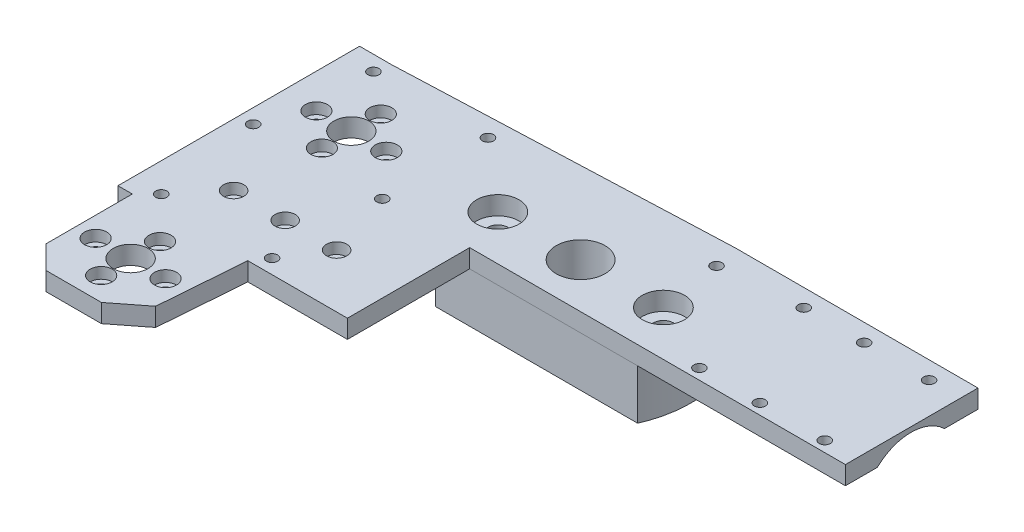
from build123d import *
from build123d.topology import SkipClean

# Parameters (mm, degrees)
BOSS_EXTRUDE2_DEPTH      = 5
BOSS_EXTRUDE3_DEPTH      = 7.754729404
CHAMFER1_SIZE            = 5
CUT_EXTRUDE1_REACH       = 141.557
SKETCH3_R                = 1.25
SKETCH3_R_2              = 4.75
SKETCH3_R_3              = 1.5
CUT_EXTRUDE2_REACH       = 141.924
SKETCH4_R                = 6.631653289
SKETCH5_R                = 1.5
SKETCH5_R_2              = 1.25
CUT_EXTRUDE3_DEPTH       = 5
SKETCH6_R                = 3.491700942
CUT_EXTRUDE4_DEPTH       = 16
SKETCH7_R                = 3
SKETCH7_R_2              = 2.75
SKETCH7_R_3              = 5.75
CUT_EXTRUDE5_DEPTH       = 3
SKETCH8_R                = 5.75
SKETCH8_R_2              = 2.75
CUT_EXTRUDE6_DEPTH       = 2
SKETCH9_R                = 2.75
SKETCH9_R_2              = 6.631653289
BOSS_EXTRUDE4_DEPTH      = 6
SKETCH_2_W               = 117.397038357
SKETCH_2_H               = 38.743798428
CUT_EXTRUDE_1_DEPTH      = 10
CUT_EXTRUDE_2_DEPTH      = 4
CUT_EXTRUDE_2_DEPTH_BACK = 67
SKETCH_3_R               = 13.2
SKETCH_4_R               = 1.5
CUT_EXTRUDE_3_DEPTH      = 141.019029031


with BuildPart() as part:
    # Sketch1 → Boss-Extrude2 (new body)
    with BuildSketch(Plane(origin=(0, 5, 0), x_dir=(1, 0, 0), z_dir=(0, 1, 0))):
        Polygon((-59.07123662, -89.170861083), (-52.784617119, -95.434905202), (-37.7519372, -95.434905202), (-29.475784547, -88.962915789), (-27.671734368, -65.713921864), (18.946867386, -65.713921864), (44.47116766, -32.695405711), (101.529871362, -32.695405711), (101.529871362, 3.549485717), (35.581177978, 3.549485717), (-54.339944406, -0.035926105), (-62.97271212, -0.035926105), (-62.97271212, -65.713921864), (-59.07123662, -65.713921864), align=None)
    extrude(amount=-BOSS_EXTRUDE2_DEPTH)

    # Sketch2 → Boss-Extrude3 (add)
    with BuildSketch(Plane.XZ):
        with BuildLine():
            Line((-10.176598849, 8.251513657), (44.814309491, 8.251513657))
            ThreePointArc((44.814309491, 8.251513657), (46.686044709, 14.122224346), (47.318855321, 20.251513657))
            ThreePointArc((47.318855321, 20.251513657), (46.686044709, 26.380802967), (44.814309491, 32.251513657))
            Line((44.814309491, 32.251513657), (-10.176598849, 32.251513657))
            ThreePointArc((-10.176598849, 32.251513657), (-12.681144679, 20.251513657), (-10.176598849, 8.251513657))
        make_face()
    extrude(amount=BOSS_EXTRUDE3_DEPTH)

    # Chamfer1
    chamfer1_edges = [part.edges().sort_by_distance(p)[0] for p in [
        (-12.681144679, 0, 20.251513657),
        (17.318855321, 0, 8.251513657),
    ]]
    chamfer(chamfer1_edges, length=CHAMFER1_SIZE)

    # Sketch3 → Cut-Extrude1 (cut, up to next)
    with BuildSketch(Plane.XZ, mode=Mode.PRIVATE) as cut_extrude1_sk1:
        with Locations(Location((-18.116122786, 51.13040511, 0), (0, 0, 270))):
            Circle(SKETCH3_R)
    cut_extrude1_tool1 = extrude(cut_extrude1_sk1.sketch, amount=-CUT_EXTRUDE1_REACH, mode=Mode.PRIVATE) & part.part
    # Sketch3 → Cut-Extrude1 (cut, up to next)
    with BuildSketch(Plane.XZ, mode=Mode.PRIVATE) as cut_extrude1_sk2:
        with Locations(Location((-32.116122786, 51.13040511, 0), (0, 0, 270))):
            Circle(SKETCH3_R)
    cut_extrude1_tool2 = extrude(cut_extrude1_sk2.sketch, amount=-CUT_EXTRUDE1_REACH, mode=Mode.PRIVATE) & part.part
    # Sketch3 → Cut-Extrude1 (cut, up to next)
    with BuildSketch(Plane.XZ, mode=Mode.PRIVATE) as cut_extrude1_sk3:
        with Locations(Location((-46.116122786, 51.13040511, 0), (0, 0, 270))):
            Circle(SKETCH3_R)
    cut_extrude1_tool3 = extrude(cut_extrude1_sk3.sketch, amount=-CUT_EXTRUDE1_REACH, mode=Mode.PRIVATE) & part.part
    # Sketch3 → Cut-Extrude1 (cut, up to next)
    with BuildSketch(Plane.XZ, mode=Mode.PRIVATE) as cut_extrude1_sk4:
        with Locations(Location((-44.116122786, 21.13040511, 0), (0, 0, 270))):
            Circle(SKETCH3_R_2)
    cut_extrude1_tool4 = extrude(cut_extrude1_sk4.sketch, amount=-CUT_EXTRUDE1_REACH, mode=Mode.PRIVATE) & part.part
    # Sketch3 → Cut-Extrude1 (cut, up to next)
    with BuildSketch(Plane.XZ, mode=Mode.PRIVATE) as cut_extrude1_sk5:
        with Locations(Location((-44.116122786, 81.13040511, 0), (0, 0, 270))):
            Circle(SKETCH3_R_2)
    cut_extrude1_tool5 = extrude(cut_extrude1_sk5.sketch, amount=-CUT_EXTRUDE1_REACH, mode=Mode.PRIVATE) & part.part
    # Sketch3 → Cut-Extrude1 (cut, up to next)
    with BuildSketch(Plane.XZ, mode=Mode.PRIVATE) as cut_extrude1_sk6:
        with Locations(Location((-34.616122786, 81.13040511, 0), (0, 0, 270))):
            Circle(SKETCH3_R_3)
    cut_extrude1_tool6 = extrude(cut_extrude1_sk6.sketch, amount=-CUT_EXTRUDE1_REACH, mode=Mode.PRIVATE) & part.part
    # Sketch3 → Cut-Extrude1 (cut, up to next)
    with BuildSketch(Plane.XZ, mode=Mode.PRIVATE) as cut_extrude1_sk7:
        with Locations(Location((-44.116122786, 73.13040511, 0), (0, 0, 270))):
            Circle(SKETCH3_R_3)
    cut_extrude1_tool7 = extrude(cut_extrude1_sk7.sketch, amount=-CUT_EXTRUDE1_REACH, mode=Mode.PRIVATE) & part.part
    # Sketch3 → Cut-Extrude1 (cut, up to next)
    with BuildSketch(Plane.XZ, mode=Mode.PRIVATE) as cut_extrude1_sk8:
        with Locations(Location((-53.616122786, 81.13040511, 0), (0, 0, 270))):
            Circle(SKETCH3_R_3)
    cut_extrude1_tool8 = extrude(cut_extrude1_sk8.sketch, amount=-CUT_EXTRUDE1_REACH, mode=Mode.PRIVATE) & part.part
    # Sketch3 → Cut-Extrude1 (cut, up to next)
    with BuildSketch(Plane.XZ, mode=Mode.PRIVATE) as cut_extrude1_sk9:
        with Locations(Location((-44.116122786, 89.13040511, 0), (0, 0, 270))):
            Circle(SKETCH3_R_3)
    cut_extrude1_tool9 = extrude(cut_extrude1_sk9.sketch, amount=-CUT_EXTRUDE1_REACH, mode=Mode.PRIVATE) & part.part
    # Sketch3 → Cut-Extrude1 (cut, up to next)
    with BuildSketch(Plane.XZ, mode=Mode.PRIVATE) as cut_extrude1_sk10:
        with Locations(Location((-53.616122786, 21.13040511, 0), (0, 0, 270))):
            Circle(SKETCH3_R_3)
    cut_extrude1_tool10 = extrude(cut_extrude1_sk10.sketch, amount=-CUT_EXTRUDE1_REACH, mode=Mode.PRIVATE) & part.part
    # Sketch3 → Cut-Extrude1 (cut, up to next)
    with BuildSketch(Plane.XZ, mode=Mode.PRIVATE) as cut_extrude1_sk11:
        with Locations(Location((-44.116122786, 13.13040511, 0), (0, 0, 270))):
            Circle(SKETCH3_R_3)
    cut_extrude1_tool11 = extrude(cut_extrude1_sk11.sketch, amount=-CUT_EXTRUDE1_REACH, mode=Mode.PRIVATE) & part.part
    # Sketch3 → Cut-Extrude1 (cut, up to next)
    with BuildSketch(Plane.XZ, mode=Mode.PRIVATE) as cut_extrude1_sk12:
        with Locations(Location((-34.616122786, 21.13040511, 0), (0, 0, 270))):
            Circle(SKETCH3_R_3)
    cut_extrude1_tool12 = extrude(cut_extrude1_sk12.sketch, amount=-CUT_EXTRUDE1_REACH, mode=Mode.PRIVATE) & part.part
    # Sketch3 → Cut-Extrude1 (cut, up to next)
    with BuildSketch(Plane.XZ, mode=Mode.PRIVATE) as cut_extrude1_sk13:
        with Locations(Location((-44.116122786, 29.13040511, 0), (0, 0, 270))):
            Circle(SKETCH3_R_3)
    cut_extrude1_tool13 = extrude(cut_extrude1_sk13.sketch, amount=-CUT_EXTRUDE1_REACH, mode=Mode.PRIVATE) & part.part
    add(cut_extrude1_tool1.solids().sort_by_distance((-18.116123, 0, 51.130405))[0], mode=Mode.SUBTRACT)
    add(cut_extrude1_tool2.solids().sort_by_distance((-32.116123, 0, 51.130405))[0], mode=Mode.SUBTRACT)
    add(cut_extrude1_tool3.solids().sort_by_distance((-46.116123, 0, 51.130405))[0], mode=Mode.SUBTRACT)
    add(cut_extrude1_tool4.solids().sort_by_distance((-44.116123, 0, 21.130405))[0], mode=Mode.SUBTRACT)
    add(cut_extrude1_tool5.solids().sort_by_distance((-44.116123, 0, 81.130405))[0], mode=Mode.SUBTRACT)
    add(cut_extrude1_tool6.solids().sort_by_distance((-34.616123, 0, 81.130405))[0], mode=Mode.SUBTRACT)
    add(cut_extrude1_tool7.solids().sort_by_distance((-44.116123, 0, 73.130405))[0], mode=Mode.SUBTRACT)
    add(cut_extrude1_tool8.solids().sort_by_distance((-53.616123, 0, 81.130405))[0], mode=Mode.SUBTRACT)
    add(cut_extrude1_tool9.solids().sort_by_distance((-44.116123, 0, 89.130405))[0], mode=Mode.SUBTRACT)
    add(cut_extrude1_tool10.solids().sort_by_distance((-53.616123, 0, 21.130405))[0], mode=Mode.SUBTRACT)
    add(cut_extrude1_tool11.solids().sort_by_distance((-44.116123, 0, 13.130405))[0], mode=Mode.SUBTRACT)
    add(cut_extrude1_tool12.solids().sort_by_distance((-34.616123, 0, 21.130405))[0], mode=Mode.SUBTRACT)
    add(cut_extrude1_tool13.solids().sort_by_distance((-44.116123, 0, 29.130405))[0], mode=Mode.SUBTRACT)

    # Sketch4 → Cut-Extrude2 (cut, up to next)
    with BuildSketch(Plane.XZ.offset(7.754729404), mode=Mode.PRIVATE) as cut_extrude2_sk1:
        with Locations((17.318855321, 20.251513657)):
            Circle(SKETCH4_R)
    cut_extrude2_tool1 = extrude(cut_extrude2_sk1.sketch, amount=-CUT_EXTRUDE2_REACH, mode=Mode.PRIVATE) & part.part
    # Sketch4 → Cut-Extrude2 (cut, up to next)
    with BuildSketch(Plane.XZ.offset(7.754729404), mode=Mode.PRIVATE) as cut_extrude2_sk2:
        with BuildLine():
            ThreePointArc((-2.431144679, 20.251513657), (-5.181144679, 23.001513657), (-7.931144679, 20.251513657))
            ThreePointArc((-7.931144679, 20.251513657), (-5.181144679, 17.501513657), (-2.431144679, 20.251513657))
        make_face()
    cut_extrude2_tool2 = extrude(cut_extrude2_sk2.sketch, amount=-CUT_EXTRUDE2_REACH, mode=Mode.PRIVATE) & part.part
    # Sketch4 → Cut-Extrude2 (cut, up to next)
    with BuildSketch(Plane.XZ.offset(7.754729404), mode=Mode.PRIVATE) as cut_extrude2_sk3:
        with BuildLine():
            ThreePointArc((37.068855321, 20.251513657), (39.818855321, 17.501513657), (42.568855321, 20.251513657))
            ThreePointArc((42.568855321, 20.251513657), (39.818855321, 23.001513657), (37.068855321, 20.251513657))
        make_face()
    cut_extrude2_tool3 = extrude(cut_extrude2_sk3.sketch, amount=-CUT_EXTRUDE2_REACH, mode=Mode.PRIVATE) & part.part
    add(cut_extrude2_tool1.solids().sort_by_distance((17.318855, -7.754729, 20.251514))[0], mode=Mode.SUBTRACT)
    add(cut_extrude2_tool2.solids().sort_by_distance((-5.181145, -7.754729, 20.251514))[0], mode=Mode.SUBTRACT)
    add(cut_extrude2_tool3.solids().sort_by_distance((39.818855, -7.754729, 20.251514))[0], mode=Mode.SUBTRACT)

    # Sketch5 → Cut-Extrude3 (cut)
    with BuildSketch(Plane(origin=(0, 0, 0), x_dir=(-1, 0, 0), z_dir=(0, -1, 0))):
        with Locations(Location((55.099934193, -4.140497737, 0), (0, 0, 90))):
            Circle(SKETCH5_R)
        with Locations(Location((59.058385613, -32.874923984, 0), (0, 0, 90))):
            Circle(SKETCH5_R)
        with Locations(Location((23.973639777, -4.140497737, 0), (0, 0, 90))):
            Circle(SKETCH5_R)
        with Locations(Location((23.973639777, -32.874923984, 0), (0, 0, 90))):
            Circle(SKETCH5_R)
        with Locations(Location((-37.259026719, -36.796202548, 0), (0, 0, 90))):
            Circle(SKETCH5_R)
        with Locations(Location((-14.468099575, -36.796202548, 0), (0, 0, 90))):
            Circle(SKETCH5_R)
        with Locations(Location((18.116122786, -51.13040511, 0), (0, 0, 90))):
            Circle(SKETCH5_R_2)
        with Locations(Location((32.116122786, -51.13040511, 0), (0, 0, 90))):
            Circle(SKETCH5_R_2)
        with Locations(Location((46.116122786, -51.13040511, 0), (0, 0, 90))):
            Circle(SKETCH5_R_2)
        with Locations(Location((55.099934193, -61.807320837, 0), (0, 0, 90))):
            Circle(SKETCH5_R)
        with Locations(Location((24.982681883, -61.807320837, 0), (0, 0, 90))):
            Circle(SKETCH5_R)
        with Locations(Location((-16.884070867, -61.807320837, 0), (0, 0, 90))):
            Circle(SKETCH5_R)
        with Locations(Location((-37.259026719, -3.251513657, 0), (0, 0, 90))):
            Circle(SKETCH5_R)
    extrude(amount=-CUT_EXTRUDE3_DEPTH, mode=Mode.SUBTRACT)

    # Sketch6 → Cut-Extrude4 (cut)
    with BuildSketch(Plane.XZ):
        with Locations((37.259026719, 3.251513657)):
            Circle(SKETCH6_R)
    extrude(amount=CUT_EXTRUDE4_DEPTH, mode=Mode.SUBTRACT)

    # Sketch7 → Cut-Extrude5 (cut)
    with BuildSketch(Plane(origin=(0, 5, 0), x_dir=(1, 0, 0), z_dir=(0, 1, 0))):
        with Locations(Location((-44.116122786, -89.13040511, 0), (0, 0, 270))):
            Circle(SKETCH7_R)
        with Locations(Location((-34.616122786, -81.13040511, 0), (0, 0, 270))):
            Circle(SKETCH7_R)
        with Locations(Location((-53.616122786, -81.13040511, 0), (0, 0, 270))):
            Circle(SKETCH7_R)
        with Locations(Location((-44.116122786, -73.13040511, 0), (0, 0, 270))):
            Circle(SKETCH7_R)
        with Locations(Location((-44.116122786, -29.13040511, 0), (0, 0, 270))):
            Circle(SKETCH7_R)
        with Locations(Location((-34.616122786, -21.13040511, 0), (0, 0, 270))):
            Circle(SKETCH7_R)
        with Locations(Location((-53.616122786, -21.13040511, 0), (0, 0, 270))):
            Circle(SKETCH7_R)
        with Locations(Location((-44.116122786, -13.13040511, 0), (0, 0, 270))):
            Circle(SKETCH7_R)
        with Locations(Location((-18.116122786, -51.13040511, 0), (0, 0, 270))):
            Circle(SKETCH7_R_2)
        with Locations(Location((-32.116122786, -51.13040511, 0), (0, 0, 270))):
            Circle(SKETCH7_R_2)
        with Locations(Location((-46.116122786, -51.13040511, 0), (0, 0, 270))):
            Circle(SKETCH7_R_2)
        with Locations(Location((39.818855321, -20.251513657, 0), (0, 0, 270))):
            Circle(SKETCH7_R_3)
        with Locations(Location((-5.181144679, -20.251513657, 0), (0, 0, 270))):
            Circle(SKETCH7_R_3)
    extrude(amount=-CUT_EXTRUDE5_DEPTH, mode=Mode.SUBTRACT)

    # Sketch8 → Cut-Extrude6 (cut)
    # profile 1 of 2: a face of its own
    with BuildSketch(Plane(origin=(0, 2, 0), x_dir=(1, 0, 0), z_dir=(0, 1, 0))):
        with Locations(Location((-5.181144679, -20.251513657, 0), (0, 0, 270))):
            Circle(SKETCH8_R)
        with Locations((-5.181144679, -20.251513657)):
            Circle(SKETCH8_R_2, mode=Mode.SUBTRACT)
    # profile 2 of 2: a face of its own
    with BuildSketch(Plane(origin=(0, 2, 0), x_dir=(1, 0, 0), z_dir=(0, 1, 0))):
        with Locations(Location((39.818855321, -20.251513657, 0), (0, 0, 270))):
            Circle(SKETCH8_R)
        with Locations((39.818855321, -20.251513657)):
            Circle(SKETCH8_R_2, mode=Mode.SUBTRACT)
    extrude(amount=-CUT_EXTRUDE6_DEPTH, mode=Mode.SUBTRACT)

    # Sketch9 → Boss-Extrude4 (add)
    with SkipClean():  # the faces are left unmerged after this step: merging them gives an invalid solid
        with BuildSketch(Plane.XZ.offset(7.754729404)):
            with BuildLine():
                Line((-10.176598849, 8.251513657), (44.814309491, 8.251513657))
                ThreePointArc((44.814309491, 8.251513657), (47.318855321, 20.251513657), (44.814309491, 32.251513657))
                Line((44.814309491, 32.251513657), (-10.176598849, 32.251513657))
                ThreePointArc((-10.176598849, 32.251513657), (-12.681144679, 20.251513657), (-10.176598849, 8.251513657))
            make_face()
            with Locations((-5.181144679, 20.251513657)):
                Circle(SKETCH9_R, mode=Mode.SUBTRACT)
            with Locations((39.818855321, 20.251513657)):
                Circle(SKETCH9_R, mode=Mode.SUBTRACT)
            with Locations((17.318855321, 20.251513657)):
                Circle(SKETCH9_R_2, mode=Mode.SUBTRACT)
        extrude(amount=BOSS_EXTRUDE4_DEPTH)
    add(part.part.scale(1), mode=Mode.REPLACE)  # the faces are merged on a copy

    # 草图2 → 切除-拉伸1 (cut)
    with BuildSketch(Plane(origin=(0, 5, 0), x_dir=(1, 0, 0), z_dir=(0, 1, 0))):
        with Locations((58.095885681, -51.858505896)):
            Rectangle(SKETCH_2_W, SKETCH_2_H)
    extrude(amount=-CUT_EXTRUDE_1_DEPTH, mode=Mode.SUBTRACT)

    # 草图3 → 切除-拉伸2 (cut, two sides: drawn at the far end of the back side and taken through both)
    with BuildSketch(Plane.ZY.offset(-52.22728788).offset(-CUT_EXTRUDE_2_DEPTH_BACK)):
        with Locations((14.680033502, -9.534061002)):
            Circle(SKETCH_3_R)
    extrude(amount=CUT_EXTRUDE_2_DEPTH + CUT_EXTRUDE_2_DEPTH_BACK, mode=Mode.SUBTRACT)

    # 草图4 → 切除-拉伸3 (cut, through all)
    with BuildSketch(Plane.XZ):
        with Locations(Location((75.385488533, 1.248685424, 0), (0, 0, 270))):
            Circle(SKETCH_4_R)
        with Locations(Location((58.961198533, 1.248685424, 0), (0, 0, 270))):
            Circle(SKETCH_4_R)
        with Locations(Location((93.027403988, 1.248685424, 0), (0, 0, 270))):
            Circle(SKETCH_4_R)
        with Locations(Location((93.027403988, 29.597239809, 0), (0, 0, 270))):
            Circle(SKETCH_4_R)
        with Locations(Location((75.385488533, 29.597239809, 0), (0, 0, 270))):
            Circle(SKETCH_4_R)
        with Locations(Location((58.961198533, 29.597239809, 0), (0, 0, 270))):
            Circle(SKETCH_4_R)
    extrude(amount=-CUT_EXTRUDE_3_DEPTH, mode=Mode.SUBTRACT)


solid = part.part
